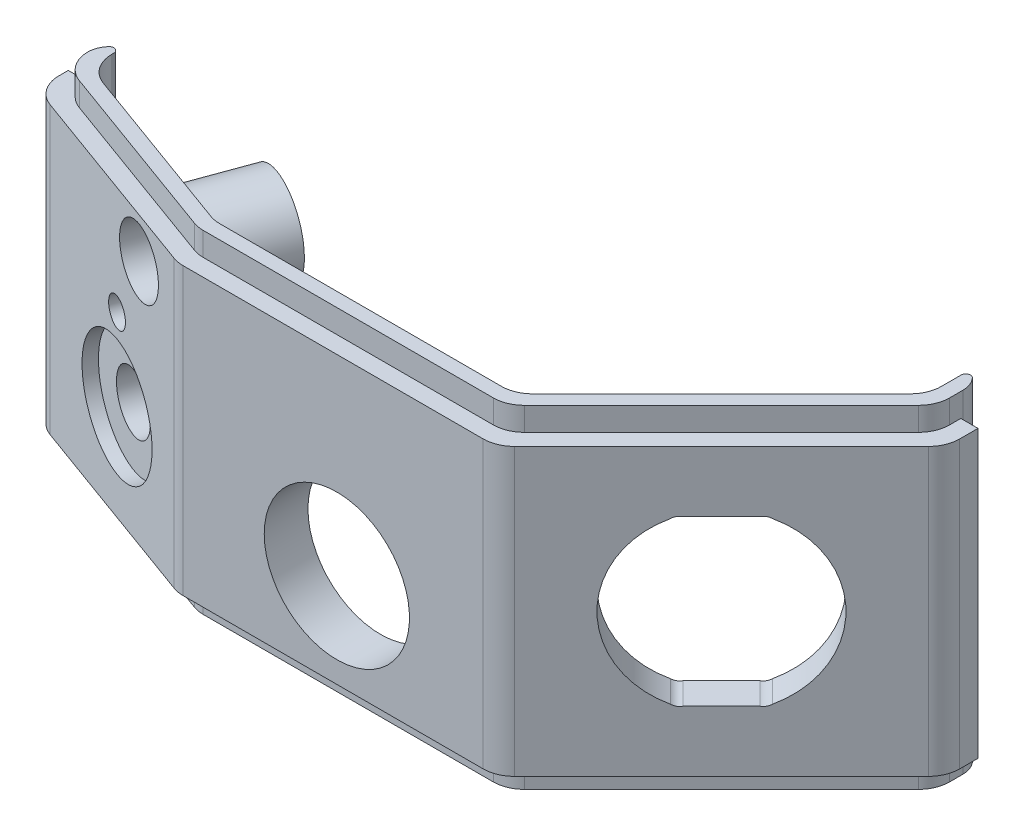
from build123d import *

# Parameters (mm, degrees)
BOSS_EXTRUDE1_DEPTH     = 13.6525
CUT_EXTRUDE1_DEPTH      = 2.032
CUT_EXTRUDE9_DEPTH      = 0.127
FILLET3_R               = 2.54
FILLET4_R               = 2.54
SKETCH5_W               = 1.905
SKETCH5_H               = 23.241
CUT_EXTRUDE4_DEPTH      = 1.397
SKETCH6_W               = 1.905
SKETCH6_H               = 23.241
CUT_EXTRUDE5_DEPTH      = 1.397
SKETCH32_R              = 5.9944
BOSS_EXTRUDE4_DEPTH     = 1.5494
F_12_28_TAPPED_HOLE1_D  = 4.6228
SKETCH33_R              = 4.7625
SKETCH33_R_2            = 1.143
CUT_EXTRUDE16_DEPTH     = 1.0414
SKETCH34_R              = 8.7503
BOSS_EXTRUDE5_DEPTH     = 1.016
F_1_2_28_TAPPED_HOLE2_D = 11.811
CUT_EXTRUDE10_DEPTH     = 50.368791583
SKETCH27_R              = 3.7084
BOSS_EXTRUDE3_DEPTH     = 6.223
CUT_EXTRUDE13_DEPTH     = 1.143
SKETCH31_R              = 2.6416
CUT_EXTRUDE15_DEPTH     = 40.985274843
FILLET5_R               = 0.79375
FILLET6_R               = 1.905
FILLET7_R               = 0.381


with BuildPart() as part:
    # Sketch1 → Boss-Extrude1 (new, symmetric)
    with BuildSketch(Plane(origin=(0, 0, 0), x_dir=(1, 0, 0), z_dir=(0, 1, 0))):
        Polygon((-12.956855136, 0), (12.956855136, 0), (31.280615395, 18.323760259), (31.280615395, 22.768760259), (28.740615395, 22.768760259), (28.740615395, 19.375862707), (11.904752688, 2.54), (-12.508984605, 2.54), (-28.383984605, 8.318027469), (-28.383984605, 10.984500322), (-30.923984605, 10.984500322), (-30.923984605, 6.539500322), align=None)
    extrude(amount=BOSS_EXTRUDE1_DEPTH, both=True)

    # Sketch2 → Cut-Extrude1 (cut)
    with BuildSketch(Plane.XZ.offset(13.6525)):
        Polygon((12.378198789, -1.397), (29.883615395, -18.902416606), (29.883615395, -22.768760259), (31.280615395, -22.768760259), (31.280615395, -18.323760259), (12.956855136, 0), (-12.956855136, 0), (-30.923984605, -6.539500322), (-30.923984605, -10.984500322), (-29.526984605, -10.984500322), (-29.526984605, -7.517690253), (-12.710526344, -1.397), align=None)
    cut_extrude1 = extrude(amount=-CUT_EXTRUDE1_DEPTH, mode=Mode.SUBTRACT)

    # Sketch17 → Cut-Extrude9 (cut)
    with BuildSketch(Plane.XZ.offset(13.6525)):
        Polygon((28.740615395, -22.768760259), (29.883615395, -22.768760259), (29.883615395, -18.902416606), (12.378198789, -1.397), (-12.710526344, -1.397), (-29.526984605, -7.517690253), (-29.526984605, -10.984500322), (-28.383984605, -10.984500322), (-28.383984605, -8.318027469), (-12.508984605, -2.54), (11.904752688, -2.54), (28.740615395, -19.375862707), align=None)
    cut_extrude9 = extrude(amount=-CUT_EXTRUDE9_DEPTH, mode=Mode.SUBTRACT)

    # Mirror1: Cut-Extrude1, Cut-Extrude9 across plane
    add(cut_extrude1.mirror(Plane.ZX), mode=Mode.SUBTRACT)
    add(cut_extrude9.mirror(Plane.ZX), mode=Mode.SUBTRACT)

    # Fillet3
    fillet3_edges = [part.edges().sort_by_distance(p)[0] for p in [
        (-30.923984605, 0, -6.539500322),
        (31.280615395, 0, -18.323760259),
        (12.956855136, 0, 0),
        (-12.956855136, 0, 0),
        (-29.526984605, 12.573, -7.517690253),
        (-12.710526344, 12.573, -1.397),
        (12.378198789, 12.573, -1.397),
        (29.883615395, 12.573, -18.902416606),
        (29.883615395, -12.573, -18.902416606),
        (12.378198789, -12.573, -1.397),
        (-12.710526344, -12.573, -1.397),
        (-29.526984605, -12.573, -7.517690253),
    ]]
    fillet(fillet3_edges, radius=FILLET3_R)

    # Fillet4
    fillet4_edges = [part.edges().sort_by_distance(p)[0] for p in [
        (-28.383984605, 0, -8.318027469),
        (-12.508984605, 0, -2.54),
        (11.904752688, 0, -2.54),
        (28.740615395, 0, -19.375862707),
    ]]
    fillet(fillet4_edges, radius=FILLET4_R)

    # Sketch5 → Cut-Extrude4 (cut)
    with BuildSketch(Plane(origin=(31.280615395, 0, 0), x_dir=(0, 0, -1), z_dir=(1, 0, 0))):
        with Locations((21.816260259, 0)):
            Rectangle(SKETCH5_W, SKETCH5_H)
    extrude(amount=-CUT_EXTRUDE4_DEPTH, mode=Mode.SUBTRACT)

    # Sketch6 → Cut-Extrude5 (cut)
    with BuildSketch(Plane.ZY.offset(30.923984605)):
        with Locations((-10.032000322, 0)):
            Rectangle(SKETCH6_W, SKETCH6_H)
    extrude(amount=-CUT_EXTRUDE5_DEPTH, mode=Mode.SUBTRACT)

    # Sketch32 → Boss-Extrude4 (add)
    with BuildSketch(Plane(origin=(-0.646932965, 0, 1.777433714), x_dir=(-0.9396926207859079, 0, -0.3420201433256701), z_dir=(0.3420201433256701, 0, -0.9396926207859079))):
        with Locations(Location((20.404914452, -3.81, 0), (0, 0, 180))):
            Circle(SKETCH32_R)
    extrude(amount=BOSS_EXTRUDE4_DEPTH)

    # #12-28 Tapped Hole1 (through all)
    with Locations(Plane(origin=(-0.117006955, 0, 0.321473968), x_dir=(0.9396926207859079, 0, 0.3420201433256701), z_dir=(0.3420201433256701, 0, -0.9396926207859079))):
        with Locations((-20.404914452, 3.81)):
            Hole(F_12_28_TAPPED_HOLE1_D / 2)

    # Sketch33 → Cut-Extrude16 (cut)
    with BuildSketch(Plane(origin=(-1.515664129, 0, 4.164252971), x_dir=(0.9396926207859079, 0, 0.34202014332567005), z_dir=(-0.34202014332567005, 0, 0.9396926207859079))):
        with Locations((-20.404914452, -3.81)):
            Circle(SKETCH33_R)
        with Locations((-20.404914452, 2.8448)):
            Circle(SKETCH33_R_2)
    extrude(amount=-CUT_EXTRUDE16_DEPTH, mode=Mode.SUBTRACT)

    # Sketch34 → Boss-Extrude5 (add)
    with BuildSketch(Plane(origin=(0, 0, -2.54), x_dir=(-1, 0, 0), z_dir=(0, 0, -1))):
        with Locations(Location((0, -3.9751, 0), (0, 0, 180))):
            Circle(SKETCH34_R)
    extrude(amount=BOSS_EXTRUDE5_DEPTH)

    # 1/2-28 Tapped Hole2 (through all)
    with Locations(Plane(origin=(0, 0, -3.556), x_dir=(1, 0, 0), z_dir=(0, 0, -1))):
        with Locations((0, 3.9751)):
            Hole(F_1_2_28_TAPPED_HOLE2_D / 2)

    # Sketch22 → Cut-Extrude10 (cut, through all)
    with BuildSketch(Plane(origin=(6.478427568, 0, 6.478427568), x_dir=(0.7071067811865479, 0, -0.7071067811865472), z_dir=(0.7071067811865472, 0, 0.7071067811865479))):
        with BuildLine():
            Line((24.341545605, 6.6802), (19.895924926, 6.6802))
            ThreePointArc((19.895924926, 6.6802), (19.52095099, 6.677571434), (19.176049558, 6.53041382))
            ThreePointArc((19.176049558, 6.53041382), (14.955935265, 0), (19.176049558, -6.53041382))
            ThreePointArc((19.176049558, -6.53041382), (19.52095099, -6.677571434), (19.895924926, -6.6802))
            Line((19.895924926, -6.6802), (24.341545605, -6.6802))
            ThreePointArc((24.341545605, -6.6802), (24.716519541, -6.677571434), (25.061420973, -6.53041382))
            ThreePointArc((25.061420973, -6.53041382), (29.281535265, 0), (25.061420973, 6.53041382))
            ThreePointArc((25.061420973, 6.53041382), (24.716519541, 6.677571434), (24.341545605, 6.6802))
        make_face()
    extrude(amount=-CUT_EXTRUDE10_DEPTH, mode=Mode.SUBTRACT)

    # Sketch27 → Boss-Extrude3 (add)
    with BuildSketch(Plane(origin=(-0.646932965, 0, 1.777433714), x_dir=(-0.9396926207859079, 0, -0.3420201433256701), z_dir=(0.3420201433256701, 0, -0.9396926207859079))):
        with Locations(Location((17.414602222, 8.3439, 0), (0, 0, 180))):
            Circle(SKETCH27_R)
    extrude(amount=BOSS_EXTRUDE3_DEPTH)

    # Sketch30 → Cut-Extrude13 (cut)
    with BuildSketch(Plane(origin=(1.481458387, 0, -4.070273465), x_dir=(-0.9396926207859079, 0, -0.34202014332567005), z_dir=(0.34202014332567005, 0, -0.9396926207859079))):
        with BuildLine():
            Line((16.146138227, 10.9855), (18.683066217, 10.9855))
            ThreePointArc((18.683066217, 10.9855), (18.999757633, 10.976126048), (19.2627898, 10.799503844))
            ThreePointArc((19.2627898, 10.799503844), (17.414602222, 5.2705), (15.566414644, 10.799503844))
            ThreePointArc((15.566414644, 10.799503844), (15.829446811, 10.976126048), (16.146138227, 10.9855))
        make_face()
    extrude(amount=-CUT_EXTRUDE13_DEPTH, mode=Mode.SUBTRACT)

    # Sketch31 → Cut-Extrude15 (cut, through all)
    with BuildSketch(Plane(origin=(1.090529363, 0, -2.996204799), x_dir=(-0.9396926207859079, 0, -0.34202014332567005), z_dir=(0.34202014332567005, 0, -0.9396926207859079))):
        with Locations((17.414602222, 8.3439)):
            Circle(SKETCH31_R)
    extrude(amount=-CUT_EXTRUDE15_DEPTH, mode=Mode.SUBTRACT)

    # Fillet5
    fillet5_edges = [part.edges().sort_by_distance(p)[0] for p in [
        (-20.496062282, 8.3439, -5.447058533),
    ]]
    fillet(fillet5_edges, radius=FILLET5_R)

    # Fillet6
    # the kernel refuses this fillet: 1.905 mm, written as the material it takes off along each edge
    with BuildSketch(Plane(origin=(29.883615395, 17.890403349, -22.768760259), x_dir=(-1.0, 0, 7.382060356189012e-12), z_dir=(0, -1, 0)), Plane(origin=(-29.526984605, -17.890403349, -10.984500322), x_dir=(1.0, 0, 7.405372125734756e-12), z_dir=(0, 1, 0))) as fillet6_piece_1:
        with BuildLine():
            CenterArc((1.905, -1.74596134), FILLET6_R, 113.578178479, 66.421821522)
            Line((0, -1.74596134), (-0.0381, -1.74596134))
            Line((-0.0381, -1.74596134), (-0.0381, 0))
            Line((-0.0381, 0), (0, 0.0381))
            ThreePointArc((0, 0.0381), (0.5715, 0.0381), (1.12776, 0.034919227))
            Line((1.12776, 0.034919227), (1.143, 0))
        make_face()
    extrude(amount=35.780806699, mode=Mode.SUBTRACT)

    # Fillet7
    fillet7_edges = [part.edges().sort_by_distance(p)[0] for p in [
        (-28.383984605, 0, -10.984500322),
        (28.740615395, 0, -22.768760259),
    ]]
    fillet(fillet7_edges, radius=FILLET7_R)


solid = part.part
